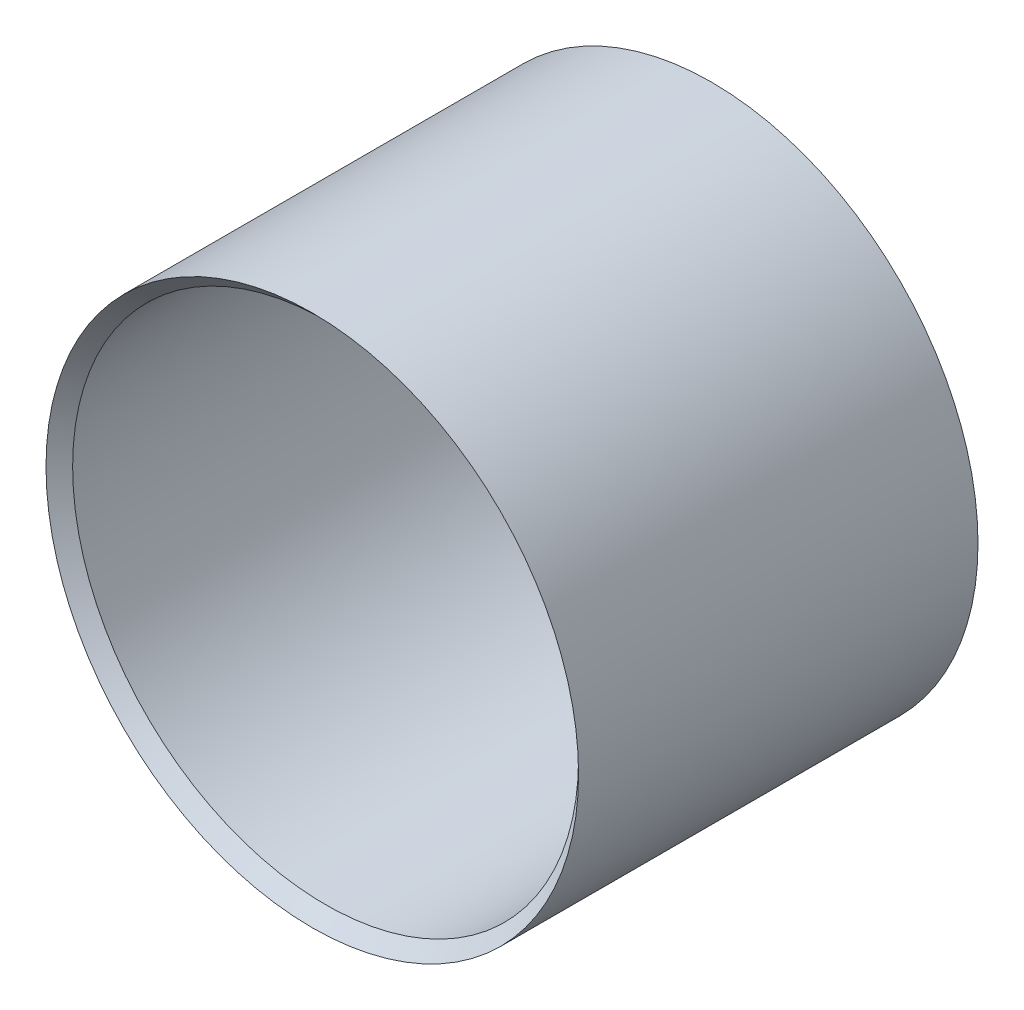
from build123d import *

# Parameters (mm, degrees)
SKETCH1_R           = 10
SKETCH1_R_2         = 9.5
BOSS_EXTRUDE1_DEPTH = 16
CHAMFER1_SIZE       = 1


with BuildPart() as part:
    # Sketch1 → Boss-Extrude1 (new body)
    with BuildSketch(Plane.XY):
        Circle(SKETCH1_R)
        Circle(SKETCH1_R_2, mode=Mode.SUBTRACT)
    extrude(amount=BOSS_EXTRUDE1_DEPTH)

    # Chamfer1
    # the kernel refuses this chamfer: 1 mm, written as the material it takes off along each edge
    with BuildSketch(Plane(origin=(0, 0, 0), x_dir=(1, 0, 0), z_dir=(0, -1, 0))) as chamfer1_piece_1:
        Polygon((9.5, CHAMFER1_SIZE), (9.5 + CHAMFER1_SIZE, 0), (9.5, 0), align=None)
    revolve(axis=Axis((0, 0, 0), (0, 0, 1)), mode=Mode.SUBTRACT)
    with BuildSketch(Plane(origin=(0, 0, 16), x_dir=(1, 0, 0), z_dir=(0, -1, 0))) as chamfer1_piece_2:
        Polygon((9.5, -CHAMFER1_SIZE), (9.5 + CHAMFER1_SIZE, 0), (9.5, 0), align=None)
    revolve(axis=Axis((0, 0, 16), (0, 0, 1)), mode=Mode.SUBTRACT)


solid = part.part
